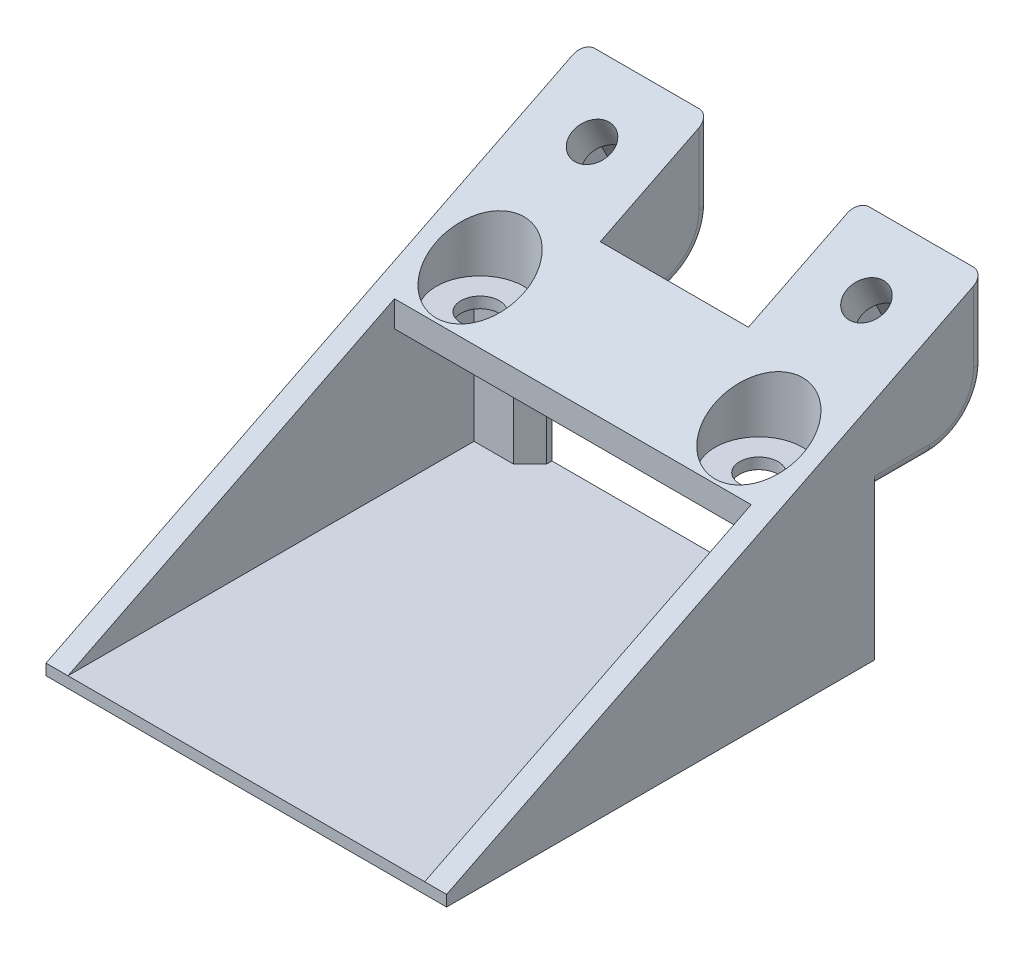
from build123d import *

# Parameters (mm, degrees)
BOSS_EXTRUDE1_DEPTH             = 16.25
CUT_EXTRUDE7_DEPTH              = 47.531565279
CUT_EXTRUDE7_DEPTH_BACK         = 47.531565279
SKETCH2_W                       = 22.3
SKETCH2_H                       = 12.5
CUT_EXTRUDE1_DEPTH              = 26.461981463
BOSS_EXTRUDE2_DEPTH             = 2
BOSS_EXTRUDE4_REACH             = 49.267
BOSS_EXTRUDE4_DIRECTION_2_REACH = 49.267
SKETCH12_R                      = 1.75
CUT_EXTRUDE8_DEPTH              = 45.835104186
CUT_EXTRUDE10_START             = -1
SKETCH14_R                      = 4
CUT_EXTRUDE10_DEPTH             = 44.835104186
SKETCH15_W                      = 36.5
SKETCH15_H                      = 38.998385445
BOSS_EXTRUDE5_DEPTH             = 1
BOSS_EXTRUDE6_DEPTH             = 36.5
SKETCH18_W                      = 13.5
SKETCH18_H                      = 10
CUT_EXTRUDE12_DEPTH             = 46.124124006
SKETCH21_R                      = 1.75
CUT_EXTRUDE15_DEPTH             = 40.773623022
CUT_EXTRUDE16_START             = -3
CUT_EXTRUDE16_DEPTH             = 37.773623022
CHAMFER1_SIZE                   = 1.5
FILLET1_R                       = 5
FILLET2_R                       = 1


with BuildPart() as part:
    # Sketch1 → Boss-Extrude1 (new, symmetric)
    with BuildSketch(Plane(origin=(0, 0, 0), x_dir=(0, 0, -1), z_dir=(1, 0, 0))):
        Polygon((0, 19.5), (0, 0), (-38.998385445, 0), align=None)
    extrude(amount=BOSS_EXTRUDE1_DEPTH, both=True)

    # Sketch10 → Cut-Extrude7 (cut, two sides: drawn at the far end of the back side and taken through both)
    with BuildSketch(Plane(origin=(0, 0, 0), x_dir=(0, 0, -1), z_dir=(1, 0, 0)).offset(-CUT_EXTRUDE7_DEPTH_BACK)):
        Polygon((-2, 0), (-2, 18.499958599), (-38.998385445, 0), align=None)
    extrude(amount=CUT_EXTRUDE7_DEPTH + CUT_EXTRUDE7_DEPTH_BACK, mode=Mode.SUBTRACT)

    # Sketch2 → Cut-Extrude1 (cut, through all)
    with BuildSketch(Plane.XY):
        with Locations((0, 6.25)):
            Rectangle(SKETCH2_W, SKETCH2_H)
    extrude(amount=CUT_EXTRUDE1_DEPTH, mode=Mode.SUBTRACT)

    # Sketch6 → Boss-Extrude2 (add)
    with BuildSketch(Plane(origin=(-16.25, 0, 0), x_dir=(0, 0, -1), z_dir=(1, 0, 0))):
        Polygon((-2, 0), (-38.998385445, 0), (-2, 18.499958599), (0, 19.5), (0, 0), align=None)
    boss_extrude2 = extrude(amount=-BOSS_EXTRUDE2_DEPTH)

    # Mirror1: Boss-Extrude2 across plane
    add(boss_extrude2.mirror(Plane(origin=(0, 0, 0), x_dir=(0, 0, 1), z_dir=(1, 0, 0))))

    # Boss-Extrude4: up to this face of the body (flat: up to its plane)
    boss_extrude4_end = Plane(part.part.faces().sort_by_distance((16.25, 6.166652866, 14.332795148))[0])
    # Sketch11 → Boss-Extrude4 (add, up to the picked face)
    with BuildSketch(Plane(origin=(0, 0, 0), x_dir=(0, 0, -1), z_dir=(1, 0, 0)), mode=Mode.PRIVATE) as boss_extrude4_sk1:
        Polygon((-2, 18.499958599), (-9.25, 14.874808522), (-9.25, 12.5), (-2, 12.5), align=None)
    boss_extrude4_tool1 = split(extrude(boss_extrude4_sk1.sketch, amount=BOSS_EXTRUDE4_REACH, mode=Mode.PRIVATE), bisect_by=boss_extrude4_end, keep=Keep.BOTH, mode=Mode.PRIVATE)
    add(boss_extrude4_tool1.solids().sort_by(Axis((0, 14.724459, 5.101954), (1, 0, 0)))[0])

    # Boss-Extrude4 direction 2: up to this face of the body (flat: up to its plane)
    boss_extrude4_direction_2_end = Plane(part.part.faces().sort_by_distance((-16.25, 6.166652866, 14.332795148))[0])
    # Sketch11 → Boss-Extrude4 direction 2 (add, up to the picked face)
    with BuildSketch(Plane(origin=(0, 0, 0), x_dir=(0, 0, -1), z_dir=(1, 0, 0)), mode=Mode.PRIVATE) as boss_extrude4_direction_2_sk1:
        Polygon((-2, 18.499958599), (-9.25, 14.874808522), (-9.25, 12.5), (-2, 12.5), align=None)
    boss_extrude4_direction_2_tool1 = split(extrude(boss_extrude4_direction_2_sk1.sketch, amount=-BOSS_EXTRUDE4_DIRECTION_2_REACH, mode=Mode.PRIVATE), bisect_by=boss_extrude4_direction_2_end, keep=Keep.BOTH, mode=Mode.PRIVATE)
    add(boss_extrude4_direction_2_tool1.solids().sort_by(Axis((0, 14.724459, 5.101954), (-1, 0, 0)))[0])

    # Sketch12 → Cut-Extrude8 (cut, through all)
    with BuildSketch(Plane.XZ.offset(-12.5)):
        with Locations(Location((-12.7, 5, 0), (0, 0, 270))):
            Circle(SKETCH12_R)
        with Locations(Location((12.7, 5, 0), (0, 0, 90))):
            Circle(SKETCH12_R)
    extrude(amount=-CUT_EXTRUDE8_DEPTH, mode=Mode.SUBTRACT)

    # Sketch14 → Cut-Extrude10 (cut, through all)
    with BuildSketch(Plane.XZ.offset(-12.5).offset(CUT_EXTRUDE10_START)):
        with Locations(Location((-12.7, 5, 0), (0, 0, 270))):
            Circle(SKETCH14_R)
        with Locations(Location((12.7, 5, 0), (0, 0, 270))):
            Circle(SKETCH14_R)
    extrude(amount=-CUT_EXTRUDE10_DEPTH, mode=Mode.SUBTRACT)

    # Sketch15 → Boss-Extrude5 (add)
    with BuildSketch(Plane.XZ):
        with Locations((0, 19.499192723)):
            Rectangle(SKETCH15_W, SKETCH15_H)
    extrude(amount=BOSS_EXTRUDE5_DEPTH)

    # Sketch17 → Boss-Extrude6 (add)
    with BuildSketch(Plane.ZY.offset(18.25)):
        Polygon((0, 19.5), (-10, 24.500207003), (-10, 12.5), (0, 12.5), align=None)
    extrude(amount=-BOSS_EXTRUDE6_DEPTH)

    # Sketch18 → Cut-Extrude12 (cut, through all)
    with BuildSketch(Plane.XZ.offset(-12.5)):
        with Locations((0, -5)):
            Rectangle(SKETCH18_W, SKETCH18_H)
    extrude(amount=-CUT_EXTRUDE12_DEPTH, mode=Mode.SUBTRACT)

    # Sketch21 → Cut-Extrude15 (cut, through all)
    with BuildSketch(Plane(origin=(0, 15.599741659, 7.800193749), x_dir=(1, 0, 0), z_dir=(0, 0.8944197849825609, 0.44722840722806245))):
        with Locations(Location((-12.5, 14.311170173, 0), (0, 0, 270))):
            Circle(SKETCH21_R)
        with Locations(Location((12.5, 14.311170173, 0), (0, 0, 172.6663404))):
            Circle(SKETCH21_R)
    extrude(amount=-CUT_EXTRUDE15_DEPTH, mode=Mode.SUBTRACT)

    # Sketch22 → Cut-Extrude16 (cut, through all)
    with BuildSketch(Plane(origin=(0, 15.599741659, 7.800193749), x_dir=(1, 0, 0), z_dir=(0, 0.8944197849825609, 0.44722840722806245)).offset(CUT_EXTRUDE16_START)):
        Polygon((12.5, 18.063946922), (9.25, 16.187558548), (9.25, 12.434781798), (12.5, 10.558393423), (15.75, 12.434781798), (15.75, 16.187558548), align=None)
        Polygon((-12.5, 18.063946922), (-15.75, 16.187558548), (-15.75, 12.434781798), (-12.5, 10.558393423), (-9.25, 12.434781798), (-9.25, 16.187558548), align=None)
    extrude(amount=-CUT_EXTRUDE16_DEPTH, mode=Mode.SUBTRACT)

    # Chamfer1
    chamfer1_edges = [part.edges().sort_by_distance(p)[0] for p in [
        (11.15, 6.25, 2),
        (-11.15, 6.25, 2),
    ]]
    chamfer(chamfer1_edges, length=CHAMFER1_SIZE)

    # Fillet1
    # the kernel refuses this fillet: 5 mm, written as the material it takes off along each edge
    with BuildSketch(Plane(origin=(-21.75, 12.5, -10), x_dir=(0, 0, 1), z_dir=(1, 0, 0)), Plane(origin=(3.25, 12.5, -10), x_dir=(0, 0, 1), z_dir=(1, 0, 0))) as fillet1_piece_1:
        with BuildLine():
            CenterArc((FILLET1_R, -FILLET1_R), FILLET1_R, 90, 90)
            Line((0, -FILLET1_R), (0, 0))
            Line((0, 0), (FILLET1_R, 0))
        make_face()
    extrude(amount=27.5, mode=Mode.SUBTRACT)

    # Fillet2
    fillet2_edges = [part.edges().sort_by_distance(p)[0] for p in [
        (-18.25, 21.000103501, -10),
        (18.25, 12.5, -2.5),
        (-6.75, 21.000103501, -10),
        (6.75, 21.000103501, -10),
        (-6.75, 12.5, -2.5),
        (-18.25, 12.5, -2.5),
        (-18.25, 13.964466094, -8.535533906),
        (6.75, 12.5, -2.5),
        (-6.75, 13.964466094, -8.535533906),
        (18.25, 21.000103501, -10),
        (6.75, 13.964466094, -8.535533906),
        (18.25, 13.964466094, -8.535533906),
    ]]
    fillet(fillet2_edges, radius=FILLET2_R)


solid = part.part
